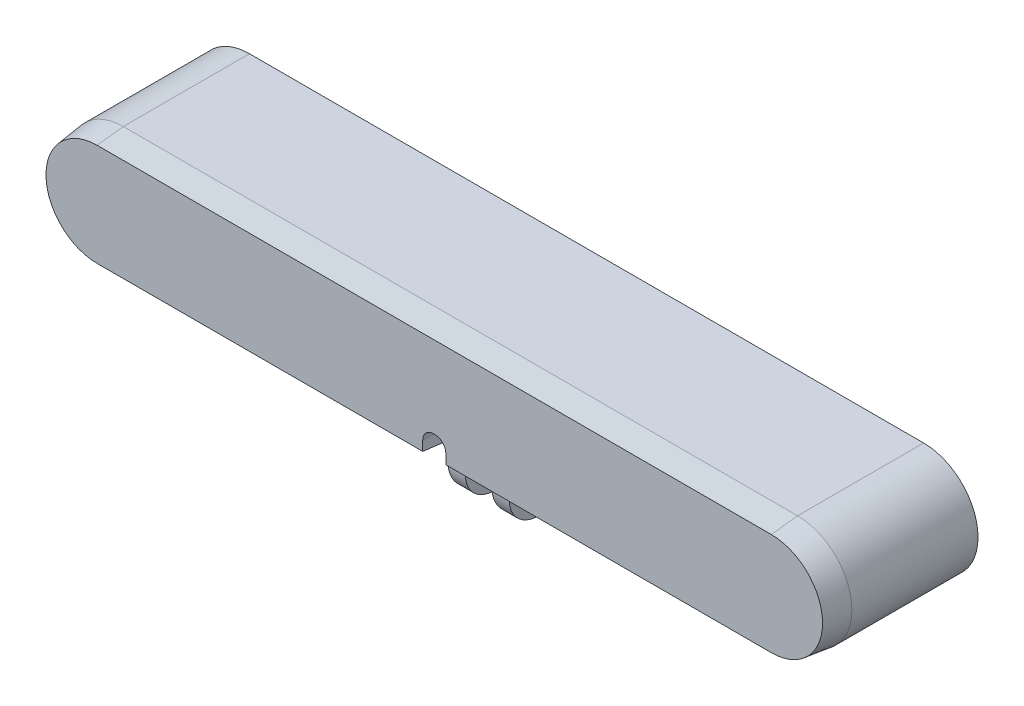
from build123d import *
from OCP.BRepFilletAPI import BRepFilletAPI_MakeChamfer

# Parameters (mm, degrees)
SKETCH1_W                 = 180
SKETCH1_H                 = 25
BOSS_EXTRUDE1_DEPTH       = 36
FILLET1_RADIUS            = 12.5
FILLET1_LENGTH            = 36
FILLET2_RADIUS            = 12.5
FILLET2_LENGTH            = 36
CHAMFER1_SIZE             = 6
CHAMFER1_SIZE2            = 0.736707365
CHAMFER2_SIZE             = 1
CHAMFER2_SIZE2            = 1.732050808
CUT_EXTRUDE1_DEPTH        = 1
CHAMFER3_SIZE             = 0.5
CHAMFER3_SIZE2            = 0.181985117
SKETCH4_R                 = 2.25
SKETCH4_R_2               = 0.5
CUT_EXTRUDE2_DEPTH        = 1
SKETCH4_2_R               = 0.5
CUT_EXTRUDE3_DEPTH        = 3
CHAMFER4_SIZE             = 0.5
CHAMFER4_SIZE2            = 0.181985117
CHAMFER4_OF_MIRROR1_SIZE2 = 0.5
CHAMFER4_OF_MIRROR1_SIZE  = 0.181985117
SKETCH6_W                 = 4.8
SKETCH6_H                 = 15
BOSS_EXTRUDE2_DEPTH       = 16
BOSS_EXTRUDE2_TAPER       = 2.5
FILLET3_R                 = 5
FILLET4_R                 = 7.104861
FILLET3_OF_MIRROR2_R      = 5
FILLET4_OF_MIRROR2_R      = 7.104861
CUT_EXTRUDE4_DEPTH        = 102.035884743
CUT_EXTRUDE4_DEPTH_BACK   = 102.035884743
SKETCH7_R                 = 2
SKETCH8_W                 = 5.3
SKETCH8_H                 = 17.3
CUT_EXTRUDE5_DEPTH        = 5.5
FILLET5_R                 = 2.5


# Some blends are built 0.0001 mm under size
with BuildPart() as part:
    # Sketch1 → Boss-Extrude1 (new body)
    with BuildSketch(Plane.XY):
        Rectangle(SKETCH1_W, SKETCH1_H)
    extrude(amount=BOSS_EXTRUDE1_DEPTH)

    # Fillet1: full round fillet: the end face becomes a half cylinder, R = half its width
    fillet1_face = Plane((90, 0, 18), x_dir=(0, 0, -1), z_dir=(1, 0, 0))  # on the end face: x along it, z out of the body
    fillet1_slab = fillet1_face.offset(-FILLET1_RADIUS / 2) * Box(FILLET1_LENGTH, 2 * FILLET1_RADIUS, FILLET1_RADIUS, mode=Mode.PRIVATE)  # the body's end, R deep
    fillet1_round = Plane((77.5, 0, 18), x_dir=(1, 0, 0), z_dir=(0, 0, -1)) * Cylinder(FILLET1_RADIUS, FILLET1_LENGTH, mode=Mode.PRIVATE)  # its axis R under the face
    add(fillet1_slab - fillet1_round, mode=Mode.SUBTRACT)

    # Fillet2: full round fillet: the end face becomes a half cylinder, R = half its width
    fillet2_face = Plane((-90, 0, 18), x_dir=(0, 0, 1), z_dir=(-1, 0, 0))  # on the end face: x along it, z out of the body
    fillet2_slab = fillet2_face.offset(-FILLET2_RADIUS / 2) * Box(FILLET2_LENGTH, 2 * FILLET2_RADIUS, FILLET2_RADIUS, mode=Mode.PRIVATE)  # the body's end, R deep
    fillet2_round = Plane((-77.5, 0, 18), x_dir=(-1, 0, 0), z_dir=(0, 0, 1)) * Cylinder(FILLET2_RADIUS, FILLET2_LENGTH, mode=Mode.PRIVATE)  # its axis R under the face
    add(fillet2_slab - fillet2_round, mode=Mode.SUBTRACT)

    # Chamfer1: one chamfer whose edges measure the first distance from different faces: ONE call of the kernel's chamfer builder (chamfer() names one face for all edges)
    chamfer1_edges_1 = [part.edges().sort_by_distance(p)[0] for p in [
        (0, 12.5, 36),
    ]]
    chamfer1_side_1 = [part.faces().sort_by_distance(p)[0] for p in [
        (0, 12.5, 18),
    ]]
    chamfer1_edges_2 = [part.edges().sort_by_distance(p)[0] for p in [
        (90, 0, 36),
    ]]
    chamfer1_side_2 = [part.faces().sort_by_distance(p)[0] for p in [
        (90, 0, 18),
    ]]
    chamfer1_edges_3 = [part.edges().sort_by_distance(p)[0] for p in [
        (0, -12.5, 36),
    ]]
    chamfer1_side_3 = [part.faces().sort_by_distance(p)[0] for p in [
        (0, -12.5, 18),
    ]]
    chamfer1_edges_4 = [part.edges().sort_by_distance(p)[0] for p in [
        (-90, 0, 36),
    ]]
    chamfer1_side_4 = [part.faces().sort_by_distance(p)[0] for p in [
        (-90, 0, 18),
    ]]
    chamfer1 = BRepFilletAPI_MakeChamfer(part.part.solid().wrapped)
    for e in chamfer1_edges_1:
        chamfer1.Add(CHAMFER1_SIZE, CHAMFER1_SIZE2, e.wrapped, chamfer1_side_1[0].wrapped)  # the first distance lies on this face
    for e in chamfer1_edges_2:
        chamfer1.Add(CHAMFER1_SIZE, CHAMFER1_SIZE2, e.wrapped, chamfer1_side_2[0].wrapped)  # the first distance lies on this face
    for e in chamfer1_edges_3:
        chamfer1.Add(CHAMFER1_SIZE, CHAMFER1_SIZE2, e.wrapped, chamfer1_side_3[0].wrapped)  # the first distance lies on this face
    for e in chamfer1_edges_4:
        chamfer1.Add(CHAMFER1_SIZE, CHAMFER1_SIZE2, e.wrapped, chamfer1_side_4[0].wrapped)  # the first distance lies on this face
    add(Compound.cast(chamfer1.Shape()), mode=Mode.REPLACE)

    # Chamfer2: one chamfer whose edges measure the first distance from different faces: ONE call of the kernel's chamfer builder (chamfer() names one face for all edges)
    chamfer2_edges_1 = [part.edges().sort_by_distance(p)[0] for p in [
        (0, 12.5, 0),
    ]]
    chamfer2_side_1 = [part.faces().sort_by_distance(p)[0] for p in [
        (0, 12.5, 15),
    ]]
    chamfer2_edges_2 = [part.edges().sort_by_distance(p)[0] for p in [
        (90, 0, 0),
    ]]
    chamfer2_side_2 = [part.faces().sort_by_distance(p)[0] for p in [
        (90, 0, 15),
    ]]
    chamfer2_edges_3 = [part.edges().sort_by_distance(p)[0] for p in [
        (0, -12.5, 0),
    ]]
    chamfer2_side_3 = [part.faces().sort_by_distance(p)[0] for p in [
        (0, -12.5, 15),
    ]]
    chamfer2_edges_4 = [part.edges().sort_by_distance(p)[0] for p in [
        (-90, 0, 0),
    ]]
    chamfer2_side_4 = [part.faces().sort_by_distance(p)[0] for p in [
        (-90, 0, 15),
    ]]
    chamfer2 = BRepFilletAPI_MakeChamfer(part.part.solid().wrapped)
    for e in chamfer2_edges_1:
        chamfer2.Add(CHAMFER2_SIZE, CHAMFER2_SIZE2, e.wrapped, chamfer2_side_1[0].wrapped)  # the first distance lies on this face
    for e in chamfer2_edges_2:
        chamfer2.Add(CHAMFER2_SIZE, CHAMFER2_SIZE2, e.wrapped, chamfer2_side_2[0].wrapped)  # the first distance lies on this face
    for e in chamfer2_edges_3:
        chamfer2.Add(CHAMFER2_SIZE, CHAMFER2_SIZE2, e.wrapped, chamfer2_side_3[0].wrapped)  # the first distance lies on this face
    for e in chamfer2_edges_4:
        chamfer2.Add(CHAMFER2_SIZE, CHAMFER2_SIZE2, e.wrapped, chamfer2_side_4[0].wrapped)  # the first distance lies on this face
    add(Compound.cast(chamfer2.Shape()), mode=Mode.REPLACE)

    # Sketch2 → Cut-Extrude1 (cut)
    with BuildSketch(Plane(origin=(0, 0, 0), x_dir=(-1, 0, 0), z_dir=(0, 0, -1))):
        with BuildLine():
            Line((-46.75, 9.25), (-20.25, 9.25))
            ThreePointArc((-20.25, 9.25), (-11, 0), (-20.25, -9.25))
            Line((-20.25, -9.25), (-46.75, -9.25))
            ThreePointArc((-46.75, -9.25), (-56, 0), (-46.75, 9.25))
        make_face()
        with BuildLine():
            Line((46.75, 9.25), (20.25, 9.25))
            ThreePointArc((20.25, 9.25), (11, 0), (20.25, -9.25))
            Line((20.25, -9.25), (46.75, -9.25))
            ThreePointArc((46.75, -9.25), (56, 0), (46.75, 9.25))
        make_face()
    extrude(amount=-CUT_EXTRUDE1_DEPTH, mode=Mode.SUBTRACT)

    # Chamfer3
    chamfer3_edges = [part.edges().sort_by_distance(p)[0] for p in [
        (56, 0, 0),
        (33.5, -9.25, 0),
        (11, 0, 0),
        (33.5, 9.25, 0),
        (-56, 0, 0),
        (-33.5, 9.25, 0),
        (-11, 0, 0),
        (-33.5, -9.25, 0),
    ]]
    chamfer3_side = [part.faces().sort_by_distance(p)[0] for p in [
        (0, 0, 0),
    ]]
    chamfer(chamfer3_edges, length=CHAMFER3_SIZE, length2=CHAMFER3_SIZE2, reference=chamfer3_side[0])

    # Sketch4 → Cut-Extrude2 (cut)
    with BuildSketch(Plane(origin=(0, 0, 0), x_dir=(-1, 0, 0), z_dir=(0, 0, -1))):
        with Locations((-74, -5)):
            Circle(SKETCH4_R)
        with Locations((-74, -5)):
            Circle(SKETCH4_R_2, mode=Mode.SUBTRACT)
        with BuildLine():
            ThreePointArc((-72.589778643, -3.377108838), (-71.85, -5), (-72.589778643, -6.622891162))
            ThreePointArc((-72.589778643, -6.622891162), (-73.154078646, -6.583324687), (-73.114512171, -6.019024683))
            ThreePointArc((-73.114512171, -6.019024683), (-72.65, -5), (-73.114512171, -3.980975317))
            ThreePointArc((-73.114512171, -3.980975317), (-73.154078646, -3.416675313), (-72.589778643, -3.377108838))
        make_face(mode=Mode.SUBTRACT)
        with BuildLine():
            ThreePointArc((-75.410221357, -6.622891162), (-76.15, -5), (-75.410221357, -3.377108838))
            ThreePointArc((-75.410221357, -3.377108838), (-74.845921354, -3.416675313), (-74.885487829, -3.980975317))
            ThreePointArc((-74.885487829, -3.980975317), (-75.35, -5), (-74.885487829, -6.019024683))
            ThreePointArc((-74.885487829, -6.019024683), (-74.845921354, -6.583324687), (-75.410221357, -6.622891162))
        make_face(mode=Mode.SUBTRACT)
    cut_extrude2 = extrude(amount=-CUT_EXTRUDE2_DEPTH, mode=Mode.SUBTRACT)

    # Sketch4<2> → Cut-Extrude3 (cut)
    with BuildSketch(Plane(origin=(0, 0, 0), x_dir=(-1, 0, 0), z_dir=(0, 0, -1))):
        with BuildLine():
            ThreePointArc((-74.885487829, -6.019024683), (-74.845921354, -6.583324687), (-75.410221357, -6.622891162))
            ThreePointArc((-75.410221357, -6.622891162), (-76.15, -5), (-75.410221357, -3.377108838))
            ThreePointArc((-75.410221357, -3.377108838), (-74.845921354, -3.416675313), (-74.885487829, -3.980975317))
            ThreePointArc((-74.885487829, -3.980975317), (-75.35, -5), (-74.885487829, -6.019024683))
        make_face()
        with BuildLine():
            ThreePointArc((-73.114512171, -3.980975317), (-73.154078646, -3.416675313), (-72.589778643, -3.377108838))
            ThreePointArc((-72.589778643, -3.377108838), (-71.85, -5), (-72.589778643, -6.622891162))
            ThreePointArc((-72.589778643, -6.622891162), (-73.154078646, -6.583324687), (-73.114512171, -6.019024683))
            ThreePointArc((-73.114512171, -6.019024683), (-72.65, -5), (-73.114512171, -3.980975317))
        make_face()
        with Locations((-74, -5)):
            Circle(SKETCH4_2_R)
    cut_extrude3 = extrude(amount=-CUT_EXTRUDE3_DEPTH, mode=Mode.SUBTRACT)

    # Chamfer4
    chamfer4_edges = [part.edges().sort_by_distance(p)[0] for p in [
        (76.25, -5, 0),
    ]]
    chamfer4_side = [part.faces().sort_by_distance(p)[0] for p in [
        (-0.572534996, 0.038684797, 0),
    ]]
    chamfer(chamfer4_edges, length=CHAMFER4_SIZE, length2=CHAMFER4_SIZE2, reference=chamfer4_side[0])

    # Mirror1: Cut-Extrude2, Cut-Extrude3 across plane
    add(cut_extrude2.mirror(Plane(origin=(0, 0, 0), x_dir=(0, 0, 1), z_dir=(1, 0, 0))), mode=Mode.SUBTRACT)
    add(cut_extrude3.mirror(Plane(origin=(0, 0, 0), x_dir=(0, 0, 1), z_dir=(1, 0, 0))), mode=Mode.SUBTRACT)

    # Chamfer4 of Mirror1
    chamfer4_of_mirror1_edges = [part.edges().sort_by_distance(p)[0] for p in [
        (-76.25, -5, 0),
    ]]
    chamfer(chamfer4_of_mirror1_edges, length=CHAMFER4_OF_MIRROR1_SIZE, length2=CHAMFER4_OF_MIRROR1_SIZE2)

    # Sketch6 → Boss-Extrude2 (add)
    with BuildSketch(Plane.XZ.offset(12.5)):
        with Locations((-5.05, 18.7)):
            Rectangle(SKETCH6_W, SKETCH6_H)
    boss_extrude2 = extrude(amount=BOSS_EXTRUDE2_DEPTH, taper=BOSS_EXTRUDE2_TAPER)

    # Fillet3
    fillet3_edges = [part.edges().sort_by_distance(p)[0] for p in [
        (-7.45, -12.5, 18.7),
    ]]
    fillet(fillet3_edges, radius=FILLET3_R)

    # Fillet4
    fillet4_edges = [part.edges().sort_by_distance(p)[0] for p in [
        (-5.05, -28.5, 11.898575087),
        (-5.05, -28.5, 25.501424913),
    ]]
    fillet(fillet4_edges, radius=FILLET4_R - 0.0001)  # a hair under: the kernel refuses the full size

    # Mirror2: Boss-Extrude2 across plane
    add(boss_extrude2.mirror(Plane(origin=(0, 0, 0), x_dir=(0, 0, 1), z_dir=(1, 0, 0))))

    # Fillet3 of Mirror2
    fillet3_of_mirror2_edges = [part.edges().sort_by_distance(p)[0] for p in [
        (7.45, -12.5, 18.7),
    ]]
    fillet(fillet3_of_mirror2_edges, radius=FILLET3_OF_MIRROR2_R)

    # Fillet4 of Mirror2
    fillet4_of_mirror2_edges = [part.edges().sort_by_distance(p)[0] for p in [
        (5.05, -28.5, 11.898575087),
        (5.05, -28.5, 25.501424913),
    ]]
    fillet(fillet4_of_mirror2_edges, radius=FILLET4_OF_MIRROR2_R - 0.0001)  # a hair under: the kernel refuses the full size

    # Sketch7 → Cut-Extrude4 (cut, two sides: drawn at the far end of the back side and taken through both)
    with BuildSketch(Plane(origin=(0, 0, 0), x_dir=(0, 0, -1), z_dir=(1, 0, 0)).offset(-CUT_EXTRUDE4_DEPTH_BACK)):
        with Locations(Location((-18.7, -21.395138845, 0), (0, 0, 90))):
            Circle(SKETCH7_R)
    extrude(amount=CUT_EXTRUDE4_DEPTH + CUT_EXTRUDE4_DEPTH_BACK, mode=Mode.SUBTRACT)

    # Sketch8 → Cut-Extrude5 (cut)
    with BuildSketch(Plane.XZ.offset(12.5)):
        with Locations((0, 27.35)):
            Rectangle(SKETCH8_W, SKETCH8_H)
    extrude(amount=-CUT_EXTRUDE5_DEPTH, mode=Mode.SUBTRACT)

    # Fillet5
    # the kernel refuses this fillet: 2.5 mm, written as the material it adds along each edge
    with BuildSketch(Plane(origin=(-2.65, -7, 12.45), x_dir=(0, -1, 0), z_dir=(0, 0, 1)), Plane(origin=(2.65, -7, 36), x_dir=(0, -1, 0), z_dir=(0, 0, -1))) as fillet5_piece_1:
        with BuildLine():
            CenterArc((FILLET5_R, FILLET5_R), FILLET5_R, 180, 90)
            Line((0, FILLET5_R), (0, 0))
            Line((0, 0), (FILLET5_R, 0))
        make_face()
    extrude(amount=23.55)
    with BuildSketch(Plane(origin=(-2.65, -12.5, 18.7), x_dir=(0, 0, 1), z_dir=(0, 1, 0))) as fillet5_piece_2:
        with BuildLine():
            CenterArc((FILLET5_R, FILLET5_R), FILLET5_R, 180, 90)
            Line((0, FILLET5_R), (0, 0))
            Line((0, 0), (FILLET5_R, 0))
        make_face()
    extrude(amount=11.75)
    with BuildSketch(Plane(origin=(2.65, -12.5, 18.7), x_dir=(0, 0, 1), z_dir=(0, 1, 0))) as fillet5_piece_3:
        with BuildLine():
            CenterArc((FILLET5_R, -FILLET5_R), FILLET5_R, 90, 90)
            Line((0, -FILLET5_R), (0, 0))
            Line((0, 0), (FILLET5_R, 0))
        make_face()
    extrude(amount=11.75)


solid = part.part
